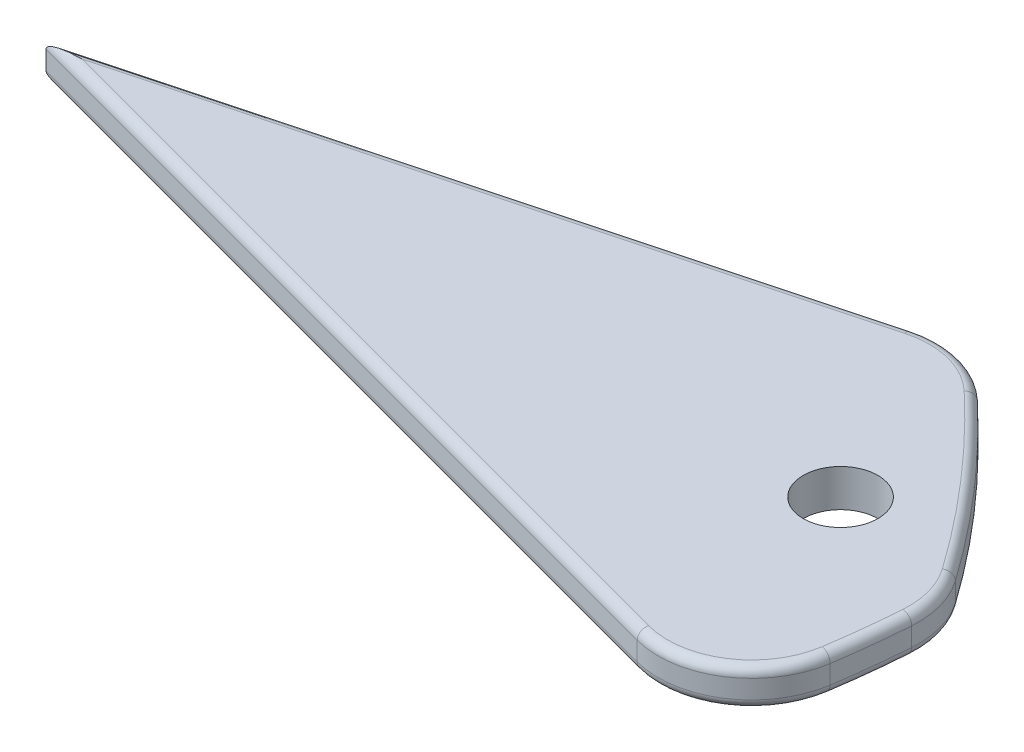
from build123d import *

# Parameters (mm, degrees)
BOSS_EXTRUDE2_DEPTH = 1
SKETCH2_R           = 2
CUT_EXTRUDE1_DEPTH  = 52.686248125
BOSS_EXTRUDE3_DEPTH = 0.5
CUT_EXTRUDE3_START  = -2
CUT_EXTRUDE3_DEPTH  = 2
FILLET1_R           = 5
FILLET2_R           = 0.5


# Read off the part's stored shape, not the designer's step: Cut-Extrude3
with BuildPart() as part:
    # Sketch1 → Boss-Extrude2 (new, symmetric)
    with BuildSketch(Plane(origin=(0, 0, 0), x_dir=(1, 0, 0), z_dir=(0, 1, 0))):
        with BuildLine():
            Line((48.296291314, -12.940952255), (0, 0))
            Line((0, 0), (48.296291314, 12.940952255))
            ThreePointArc((48.296291314, 12.940952255), (50, 0), (48.296291314, -12.940952255))
        make_face()
    extrude(amount=BOSS_EXTRUDE2_DEPTH, both=True)

    # Sketch2 → Cut-Extrude1 (cut, through all)
    with BuildSketch(Plane(origin=(0, 1, 0), x_dir=(1, 0, 0), z_dir=(0, 1, 0))):
        with Locations(Location((42.5, 0, 0), (0, 0, 270))):
            Circle(SKETCH2_R)
    extrude(amount=-CUT_EXTRUDE1_DEPTH, mode=Mode.SUBTRACT)

    # Sketch3 → Boss-Extrude3 (add)
    with BuildSketch(Plane(origin=(0, -1, 0), x_dir=(-1, 0, 0), z_dir=(0, -1, 0))):
        with BuildLine():
            Line((-38.5, -7), (-38.5, 7))
            ThreePointArc((-38.5, 7), (-38, 7.5), (-37.5, 7))
            Line((-37.5, 7), (-37.5, -7))
            ThreePointArc((-37.5, -7), (-38, -7.5), (-38.5, -7))
        make_face()
    extrude(amount=BOSS_EXTRUDE3_DEPTH)

    # Cut-Extrude3 outline → Cut-Extrude3 (cut)
    with BuildSketch(Plane(origin=(0, 1, 0), x_dir=(1, 0, 0), z_dir=(0, 1, 0)).offset(CUT_EXTRUDE3_START)):
        with BuildLine():
            ThreePointArc((39.129720832, 10.484777097), (44.969397941, 4.720942194), (49.96810207, -1.785714286))
            ThreePointArc((49.96810207, -1.785714286), (49.680896013, 5.639908806), (48.296291314, 12.940952255))
            Line((48.296291314, 12.940952255), (39.129720832, 10.484777097))
        make_face()
    extrude(amount=CUT_EXTRUDE3_DEPTH, mode=Mode.SUBTRACT)

    # Fillet1
    fillet1_edges = [part.edges().sort_by_distance(p)[0] for p in [
        (39.129720832, 0, -10.484777097),
        (49.96810207, 0, 1.785714286),
        (48.296291314, 0, 12.940952255),
    ]]
    fillet(fillet1_edges, radius=FILLET1_R)

    # Fillet2
    fillet2_edges = [part.edges().sort_by_distance(p)[0] for p in [
        (18.252899917, -1, -4.890849792),
        (18.252899917, 1, -4.890849792),
        (45.320316883, -1, -4.32008237),
        (49.692435611, -1, 5.537313704),
        (21.598758088, -1, 5.787369787),
        (47.228674266, -1, 10.929424828),
        (49.700770587, -1, 1.869330184),
        (39.027043508, -1, -9.799142423),
        (45.320316883, 1, -4.32008237),
        (21.598758088, 1, 5.787369787),
        (49.692435611, 1, 5.537313704),
        (47.228674266, 1, 10.929424828),
        (49.700770587, 1, 1.869330184),
        (39.027043508, 1, -9.799142423),
    ]]
    fillet(fillet2_edges, radius=FILLET2_R)


solid = part.part
